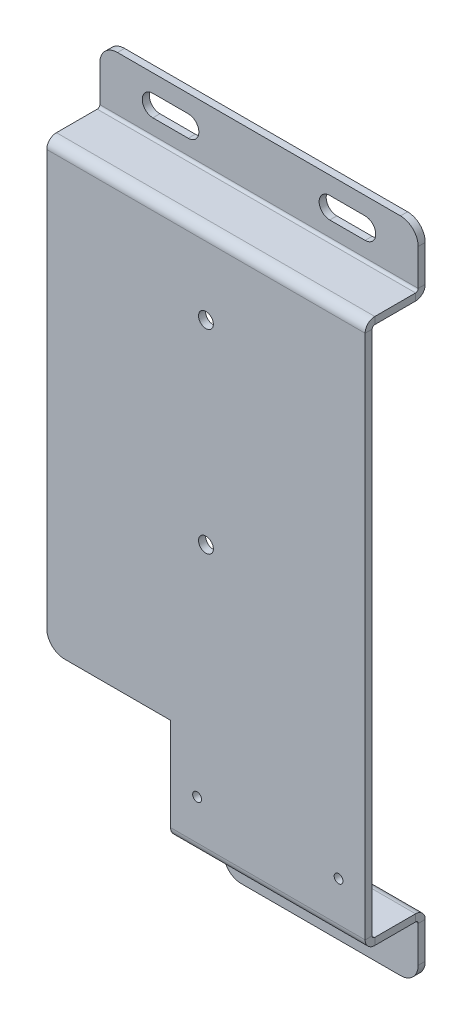
from build123d import *

# Parameters (mm, degrees)
SM_BASE_FLANGE_1_DEPTH = 45
SKETCH_3_R             = 2.1
CUT_EXTRUDE_1_DEPTH    = 105.70434566
SKETCH_4_W             = 35
SKETCH_4_H             = 45
CUT_EXTRUDE_2_DEPTH    = 105.70434566
M3X0_5_1_D             = 2.5
M3X0_5_1_DEPTH         = 7.5
M3X0_5_1_TIP           = 0.751075774
CUT_EXTRUDE_3_DEPTH    = 105.398275848
FILLET_1_R             = 5


# Sheet-metal steps are written as plain solids
with BuildPart() as part:
    # Sketch 1 → 基体-法兰1 (new, symmetric)
    with BuildSketch(Plane(origin=(0, 0, 0), x_dir=(0, 0, -1), z_dir=(1, 0, 0))):
        with BuildLine():
            Line((15, 93), (15, 77.7366))
            ThreePointArc((15, 77.7366), (14.198468417, 75.801531583), (12.2634, 75))
            Line((12.2634, 75), (0.7366, 75))
            ThreePointArc((0.7366, 75), (0.215745145, 74.784254855), (0, 74.2634))
            Line((0, 74.2634), (0, -74.2634))
            ThreePointArc((0, -74.2634), (0.215745145, -74.784254855), (0.7366, -75))
            Line((0.7366, -75), (12.2634, -75))
            ThreePointArc((12.2634, -75), (14.198468417, -75.801531583), (15, -77.7366))
            Line((15, -77.7366), (15, -93))
            Line((15, -93), (13, -93))
            Line((13, -93), (13, -77.7366))
            ThreePointArc((13, -77.7366), (12.784254855, -77.215745145), (12.2634, -77))
            Line((12.2634, -77), (0.7366, -77))
            ThreePointArc((0.7366, -77), (-1.198468417, -76.198468417), (-2, -74.2634))
            Line((-2, -74.2634), (-2, 74.2634))
            ThreePointArc((-2, 74.2634), (-1.198468417, 76.198468417), (0.7366, 77))
            Line((0.7366, 77), (12.2634, 77))
            ThreePointArc((12.2634, 77), (12.784254855, 77.215745145), (13, 77.7366))
            Line((13, 77.7366), (13, 93))
            Line((13, 93), (15, 93))
        make_face()
    extrude(amount=SM_BASE_FLANGE_1_DEPTH, both=True)

    # 草图3 → 切除-拉伸1 (cut, through all)
    with BuildSketch(Plane.XY.offset(2)):
        with Locations((0, 55)):
            Circle(SKETCH_3_R)
        Circle(SKETCH_3_R)
    extrude(amount=-CUT_EXTRUDE_1_DEPTH, mode=Mode.SUBTRACT)

    # 草图4 → 切除-拉伸2 (cut, through all)
    with BuildSketch(Plane.XY.offset(2)):
        with Locations((-27.5, -70.5)):
            Rectangle(SKETCH_4_W, SKETCH_4_H)
    extrude(amount=-CUT_EXTRUDE_2_DEPTH, mode=Mode.SUBTRACT)

    # M3x0.5 螺纹孔1
    with Locations(Plane.XY.offset(2)):
        with Locations((-2.5, -63), (37.5, -63)):
            Hole(M3X0_5_1_D / 2, depth=M3X0_5_1_DEPTH)
            with Locations((0, 0, -(M3X0_5_1_DEPTH + M3X0_5_1_TIP / 2))):  # 118° drill point
                Cone(0, M3X0_5_1_D / 2, M3X0_5_1_TIP, mode=Mode.SUBTRACT)

    # 草图7 → 切除-拉伸3 (cut, through all)
    with BuildSketch(Plane.XY.offset(-13)):
        with BuildLine():
            Line((-30, 88), (-20, 88))
            ThreePointArc((-20, 88), (-17, 85), (-20, 82))
            Line((-20, 82), (-30, 82))
            ThreePointArc((-30, 82), (-33, 85), (-30, 88))
        make_face()
        with BuildLine():
            Line((30, 88), (20, 88))
            ThreePointArc((20, 88), (17, 85), (20, 82))
            Line((20, 82), (30, 82))
            ThreePointArc((30, 82), (33, 85), (30, 88))
        make_face()
        with BuildLine():
            Line((12.5, -82), (22.5, -82))
            ThreePointArc((22.5, -82), (25.5, -85), (22.5, -88))
            Line((22.5, -88), (12.5, -88))
            ThreePointArc((12.5, -88), (9.5, -85), (12.5, -82))
        make_face()
    extrude(amount=-CUT_EXTRUDE_3_DEPTH, mode=Mode.SUBTRACT)

    # 圆角1
    fillet_1_edges = [part.edges().sort_by_distance(p)[0] for p in [
        (-45, 93, -14),
        (45, -93, -14),
        (45, 93, -14),
        (-45, -48, 1),
        (-10, -93, -14),
    ]]
    fillet(fillet_1_edges, radius=FILLET_1_R)


solid = part.part
